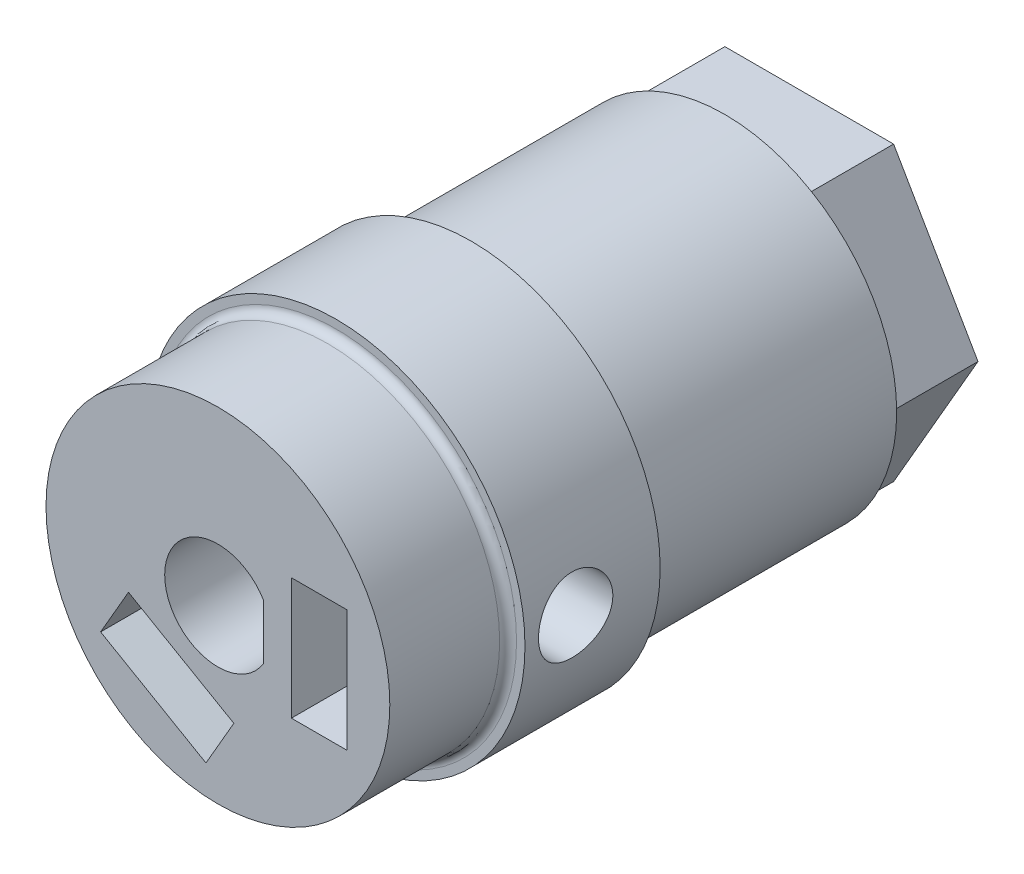
from build123d import *

# Parameters (mm, degrees)
SKETCH_2_R               = 1.75
EXTRUDE_1_DEPTH          = 5
SKETCH_3_W               = 2.5
SKETCH_3_H               = 7.4
EXTRUDE_2_DEPTH          = 15
CUT_EXTRUDE_1_DEPTH      = 0.2
CUT_EXTRUDE_1_DEPTH_BACK = 12
SKETCH_4_R               = 2.2
SKETCH_9_W               = 3.3
SKETCH_9_H               = 7.2
CUT_EXTRUDE_5_DEPTH      = 13
CUT_EXTRUDE_6_DEPTH      = 3.3
CUT_EXTRUDE_7_DEPTH      = 10
CUT_EXTRUDE_7_DEPTH_BACK = 5
SKETCH_12_R              = 2.2
CUT_EXTRUDE_8_DEPTH      = 3.4
FILLET_2_R               = 0.5


with BuildPart() as part:
    # Эскиз1 → Повернуть1 (revolve)
    with BuildSketch(Plane(origin=(0, 0, 0), x_dir=(0, 0, -1), z_dir=(1, 0, 0)), mode=Mode.PRIVATE) as revolve_1_sk:
        Polygon((0, 0), (0, 7.025), (7, 7.025), (7, 8.025), (15, 8.025), (15, 7.025), (30, 7.025), (30, -1.4), (14.5, -1.4), (14.5, 0), align=None)
    revolve(revolve_1_sk.sketch.rotate(Axis((0, -3.15, 0), (0, 0, -1)), 90), axis=Axis((0, -3.15, 0), (0, 0, -1)))

    # Эскиз2 → Бобышка-Вытянуть1 (add)
    with BuildSketch(Plane(origin=(0, 0, -30), x_dir=(-1, 0, 0), z_dir=(0, 0, -1))):
        Polygon((4.994079828, 5.5), (-4.994079828, 5.5), (-9.988159657, -3.15), (-4.994079828, -11.8), (4.994079828, -11.8), (9.988159657, -3.15), align=None)
        with Locations(Location((0, -3.15, 0), (0, 0, 180))):
            Circle(SKETCH_2_R, mode=Mode.SUBTRACT)
    extrude(amount=EXTRUDE_1_DEPTH)

    # Эскиз3 → Бобышка-Вытянуть2 (add)
    with BuildSketch(Plane.XY):
        with BuildLine():
            Line((2.7, -4.772498074), (2.7, -1.527501926))
            ThreePointArc((2.7, -1.527501926), (3.15, -3.15), (2.7, -4.772498074))
        make_face()
        with Locations((5.7, -3.15)):
            Rectangle(SKETCH_3_W, SKETCH_3_H)
    extrude(amount=-EXTRUDE_2_DEPTH)

    # Эскиз4 → Вырез-Вытянуть1 (cut, two sides: drawn at the far end of the back side and taken through both)
    with BuildSketch(Plane.ZY.offset(-2.7).offset(-CUT_EXTRUDE_1_DEPTH_BACK)):
        with Locations(Location((-10, -3.15, 0), (0, 0, 180))):
            Circle(SKETCH_4_R)
    extrude(amount=CUT_EXTRUDE_1_DEPTH + CUT_EXTRUDE_1_DEPTH_BACK, mode=Mode.SUBTRACT)

    # Скругление1: read off the stored shape, not the designer's step
    # Скругление1 outline → Скругление1 (revolve)
    with BuildSketch(Plane.XZ.offset(3.15)):
        with BuildLine():
            Line((3.15, -14.5), (3.15, -13.5))
            ThreePointArc((3.15, -13.5), (2.857106781, -14.207106781), (2.15, -14.5))
            Line((2.15, -14.5), (3.15, -14.5))
        make_face()
    revolve(axis=Axis((0, -3.15, 0), (0, 0, 1)))

    # Эскиз9 → Вырез-Вытянуть5 (cut)
    with BuildSketch(Plane.XY):
        with Locations((6, -3.15)):
            Rectangle(SKETCH_9_W, SKETCH_9_H)
        Polygon((-6.942691454, -7.975094339), (-5.292691454, -5.117210506), (0.942691454, -8.717210506), (-0.707308546, -11.575094339), align=None)
    extrude(amount=-CUT_EXTRUDE_5_DEPTH, mode=Mode.SUBTRACT)

    # Эскиз10 → Вырез-Вытянуть6 (cut)
    with BuildSketch(Plane(origin=(4.35, 0, 0), x_dir=(0, 0, -1), z_dir=(1, 0, 0))):
        Polygon((5.843078062, -3.15), (7.921539031, -6.75), (12.078460969, -6.75), (14.156921938, -3.15), (12.078460969, 0.45), (7.921539031, 0.45), align=None)
    extrude(amount=CUT_EXTRUDE_6_DEPTH, mode=Mode.SUBTRACT)

    # Эскиз12 → Вырез-Вытянуть7 (cut, two sides: drawn at the far end of the back side and taken through both)
    with BuildSketch(Plane(origin=(-3.538990011, -6.129710506, 0), x_dir=(0.8660254037844364, -0.500000000000004, 0), z_dir=(-0.500000000000004, -0.8660254037844365, 0)).offset(-CUT_EXTRUDE_7_DEPTH_BACK)):
        with Locations(Location((1.575, -10, 0), (0, 0, 180))):
            Circle(SKETCH_12_R)
    extrude(amount=CUT_EXTRUDE_7_DEPTH + CUT_EXTRUDE_7_DEPTH_BACK, mode=Mode.SUBTRACT)

    # Эскиз13 → Вырез-Вытянуть8 (cut)
    with BuildSketch(Plane(origin=(-3.538990011, -6.129710506, 0), x_dir=(0.8660254037844364, -0.500000000000004, 0), z_dir=(-0.500000000000004, -0.8660254037844365, 0))):
        Polygon((-2.025, -7.921539031), (-2.025, -12.078460969), (1.575, -14.156921938), (5.175, -12.078460969), (5.175, -7.921539031), (1.575, -5.843078062), align=None)
    extrude(amount=CUT_EXTRUDE_8_DEPTH, mode=Mode.SUBTRACT)

    # Скругление2
    fillet_2_edges = [part.edges().sort_by_distance(p)[0] for p in [
        (-10.175, -3.15, -7),
    ]]
    fillet(fillet_2_edges, radius=FILLET_2_R)


solid = part.part
